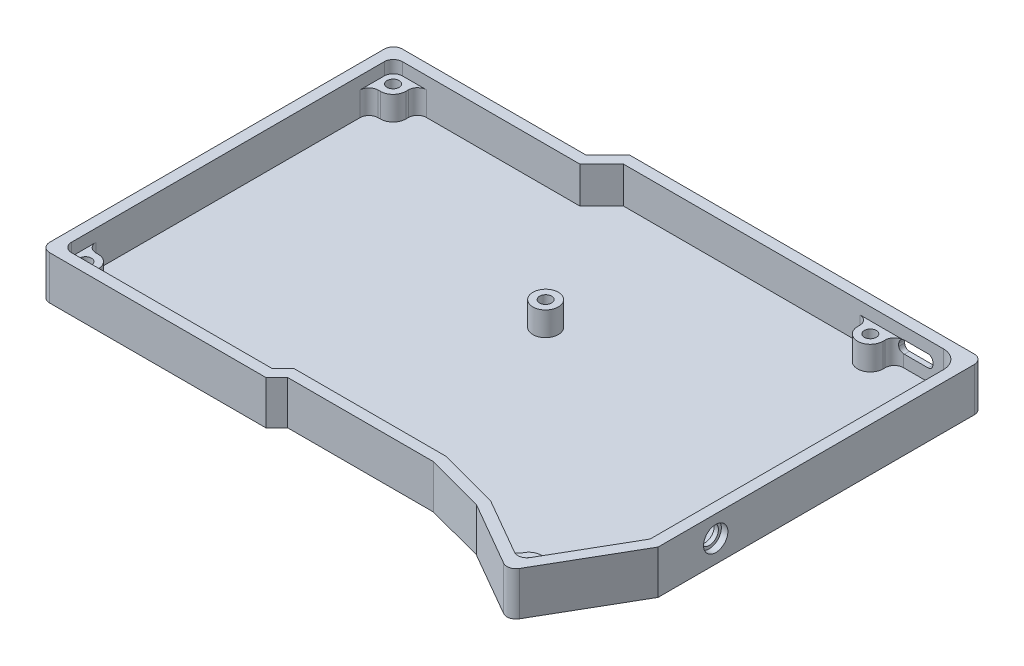
from build123d import *

# Parameters (mm, degrees)
BOSS_EXTRUDE1_DEPTH = 10
BOSS_EXTRUDE2_DEPTH = 2
FILLET1_R           = 2.5
FILLET2_R           = 2.5
FILLET4_R           = 5
BOSS_EXTRUDE3_START = 6.6
SKETCH3_R           = 3.5
BOSS_EXTRUDE3_DEPTH = 6.6
SKETCH5_R           = 1.65
CUT_EXTRUDE1_DEPTH  = 2.5
FILLET3_R           = 2.5
SKETCH6_R           = 2.55
CUT_EXTRUDE2_DEPTH  = 167.136549573
SKETCH7_R           = 3.35
CUT_EXTRUDE3_DEPTH  = 1.8
CUT_EXTRUDE4_REACH  = 141.279
SKETCH8_W           = 9.14
SKETCH8_H           = 3.36
FILLET5_R           = 1.3
CUT_EXTRUDE5_DEPTH  = 1.6


with BuildPart() as part:
    # Sketch1 → Boss-Extrude1 (new body)
    with BuildSketch(Plane(origin=(0, 0, 0), x_dir=(1, 0, 0), z_dir=(0, 1, 0))):
        Polygon((78.125, -37.9381301), (62.908489388, -64.283910205), (42.956179643, -52.779359478), (26.916138362, -48.5), (-13.175252532, -48.5), (-16.175252532, -51.5), (-78.125, -51.5), (-78.125, 45.5), (-25.074747468, 45.5), (-19.074747468, 51.5), (78.125, 51.5), align=None)
        Polygon((75.125, -37.134018586), (61.80999823, -60.187537075), (44.11188212, -49.982759925), (27.309448337, -45.5), (-14.417893219, -45.5), (-17.417893219, -48.5), (-75.125, -48.5), (-75.125, 42.5), (-23.832106781, 42.5), (-17.832106781, 48.5), (75.125, 48.5), align=None, mode=Mode.SUBTRACT)
    extrude(amount=BOSS_EXTRUDE1_DEPTH)

    # Sketch2 → Boss-Extrude2 (add)
    with BuildSketch(Plane.XZ):
        Polygon((78.125, -51.5), (78.125, 37.9381301), (62.908489388, 64.283910205), (42.956179643, 52.779359478), (26.916138362, 48.5), (-13.175252532, 48.5), (-16.175252532, 51.5), (-78.125, 51.5), (-78.125, -45.5), (-25.074747468, -45.5), (-19.074747468, -51.5), align=None)
    extrude(amount=BOSS_EXTRUDE2_DEPTH)

    # Fillet1
    fillet1_edges = [part.edges().sort_by_distance(p)[0] for p in [
        (-75.125, 5, 48.5),
        (61.80999823, 5, 60.187537075),
        (-75.125, 5, -42.5),
    ]]
    fillet(fillet1_edges, radius=FILLET1_R)

    # Fillet2
    fillet2_edges = [part.edges().sort_by_distance(p)[0] for p in [
        (-78.125, 4, 51.5),
        (62.908489388, 4, 64.283910205),
        (78.125, 4, -51.5),
        (-78.125, 4, -45.5),
    ]]
    fillet(fillet2_edges, radius=FILLET2_R)

    # Fillet4
    fillet4_edges = [part.edges().sort_by_distance(p)[0] for p in [
        (75.125, 5, -48.5),
    ]]
    fillet(fillet4_edges, radius=FILLET4_R)

    # Sketch3 → Boss-Extrude3 (add)
    with BuildSketch(Plane(origin=(0, 0, 0), x_dir=(1, 0, 0), z_dir=(0, 1, 0)).offset(BOSS_EXTRUDE3_START)):
        with BuildLine():
            Line((-68.5, 42.5), (-72.625, 42.5))
            ThreePointArc((-72.625, 42.5), (-74.392766953, 41.767766953), (-75.125, 40))
            Line((-75.125, 40), (-75.125, 35.8))
            Line((-75.125, 35.8), (-72, 35.8))
            ThreePointArc((-72, 35.8), (-69.525126266, 36.825126266), (-68.5, 39.3))
            Line((-68.5, 39.3), (-68.5, 42.5))
        make_face()
        with BuildLine():
            Line((65.06794725, -54.546742633), (62.39329915, -53.001948322))
            ThreePointArc((62.39329915, -53.001948322), (59.73723674, -52.653786957), (57.612929736, -54.285719436))
            Line((57.612929736, -54.285719436), (56.106253452, -56.898743849))
            Line((56.106253452, -56.898743849), (59.645803824, -58.939657274))
            ThreePointArc((59.645803824, -58.939657274), (61.542115723, -59.188578919), (63.059447202, -58.024248216))
            Line((63.059447202, -58.024248216), (65.06794725, -54.546742633))
        make_face()
        with BuildLine():
            Line((-72, -41.8), (-75.125, -41.8))
            Line((-75.125, -41.8), (-75.125, -46))
            ThreePointArc((-75.125, -46), (-74.392766953, -47.767766953), (-72.625, -48.5))
            Line((-72.625, -48.5), (-68.5, -48.5))
            Line((-68.5, -48.5), (-68.5, -45.3))
            ThreePointArc((-68.5, -45.3), (-69.525126266, -42.825126266), (-72, -41.8))
        make_face()
        with BuildLine():
            Line((49.645, 48.5), (49.645, 45.4))
            ThreePointArc((49.645, 45.4), (53.145, 41.9), (56.645, 45.4))
            Line((56.645, 45.4), (56.645, 48.5))
            Line((56.645, 48.5), (49.645, 48.5))
        make_face()
        with Locations((0.325, 8.92)):
            Circle(SKETCH3_R)
    extrude(amount=-BOSS_EXTRUDE3_DEPTH)

    # Sketch5 → Cut-Extrude1 (cut)
    with BuildSketch(Plane(origin=(0, 6.6, 0), x_dir=(1, 0, 0), z_dir=(0, 1, 0))):
        with Locations((-72, 39.3)):
            Circle(SKETCH5_R)
        with Locations((0.325, 8.92)):
            Circle(SKETCH5_R)
        with Locations((53.145, 45.4)):
            Circle(SKETCH5_R)
        with Locations((60.645, -56.034018586)):
            Circle(SKETCH5_R)
        with Locations((-72, -45.3)):
            Circle(SKETCH5_R)
    extrude(amount=-CUT_EXTRUDE1_DEPTH, mode=Mode.SUBTRACT)

    # Fillet3
    fillet3_edges = [part.edges().sort_by_distance(p)[0] for p in [
        (65.06794725, 3.3, 54.546742633),
        (49.645, 3.3, -48.5),
        (56.645, 3.3, -48.5),
        (-75.125, 3.3, -35.8),
        (-68.5, 3.3, -42.5),
        (-75.125, 3.3, 41.8),
        (56.106253452, 3.3, 56.898743849),
        (-68.5, 3.3, 48.5),
    ]]
    fillet(fillet3_edges, radius=FILLET3_R)

    # Sketch6 → Cut-Extrude2 (cut, through all)
    with BuildSketch(Plane.ZY.offset(-75.125)):
        with Locations((22.099069046, 4.1)):
            Circle(SKETCH6_R)
    extrude(amount=-CUT_EXTRUDE2_DEPTH, mode=Mode.SUBTRACT)

    # Sketch7 → Cut-Extrude3 (cut)
    with BuildSketch(Plane(origin=(78.125, 0, 0), x_dir=(0, 0, -1), z_dir=(1, 0, 0))):
        with Locations((-22.099069046, 4.1)):
            Circle(SKETCH7_R)
    extrude(amount=-CUT_EXTRUDE3_DEPTH, mode=Mode.SUBTRACT)

    # Sketch8 → Cut-Extrude4 (cut, up to next)
    with BuildSketch(Plane(origin=(0, 0, -51.5), x_dir=(-1, 0, 0), z_dir=(0, 0, -1)), mode=Mode.PRIVATE) as cut_extrude4_sk1:
        with Locations((-62.66, 5.02)):
            Rectangle(SKETCH8_W, SKETCH8_H)
    cut_extrude4_tool1 = extrude(cut_extrude4_sk1.sketch, amount=-CUT_EXTRUDE4_REACH, mode=Mode.PRIVATE) & part.part
    add(cut_extrude4_tool1.solids().sort_by_distance((62.66, 5.02, -51.5))[0], mode=Mode.SUBTRACT)

    # Fillet5
    fillet5_edges = [part.edges().sort_by_distance(p)[0] for p in [
        (67.23, 3.34, -50),
        (58.09, 3.34, -49.883244788),
        (58.09, 6.7, -50),
        (67.23, 6.7, -50),
    ]]
    fillet(fillet5_edges, radius=FILLET5_R)

    # Sketch9 → Cut-Extrude5 (cut)
    with BuildSketch(Plane(origin=(0, 0, -51.5), x_dir=(-1, 0, 0), z_dir=(0, 0, -1))):
        with BuildLine():
            Line((-69.73, 5.4), (-69.73, 4.64))
            ThreePointArc((-69.73, 4.64), (-68.617005769, 1.952994231), (-65.93, 0.84))
            Line((-65.93, 0.84), (-59.39, 0.84))
            ThreePointArc((-59.39, 0.84), (-56.702994231, 1.952994231), (-55.59, 4.64))
            Line((-55.59, 4.64), (-55.59, 5.4))
            ThreePointArc((-55.59, 5.4), (-56.702994231, 8.087005769), (-59.39, 9.2))
            Line((-59.39, 9.2), (-65.93, 9.2))
            ThreePointArc((-65.93, 9.2), (-68.617005769, 8.087005769), (-69.73, 5.4))
        make_face()
    extrude(amount=-CUT_EXTRUDE5_DEPTH, mode=Mode.SUBTRACT)


solid = part.part
